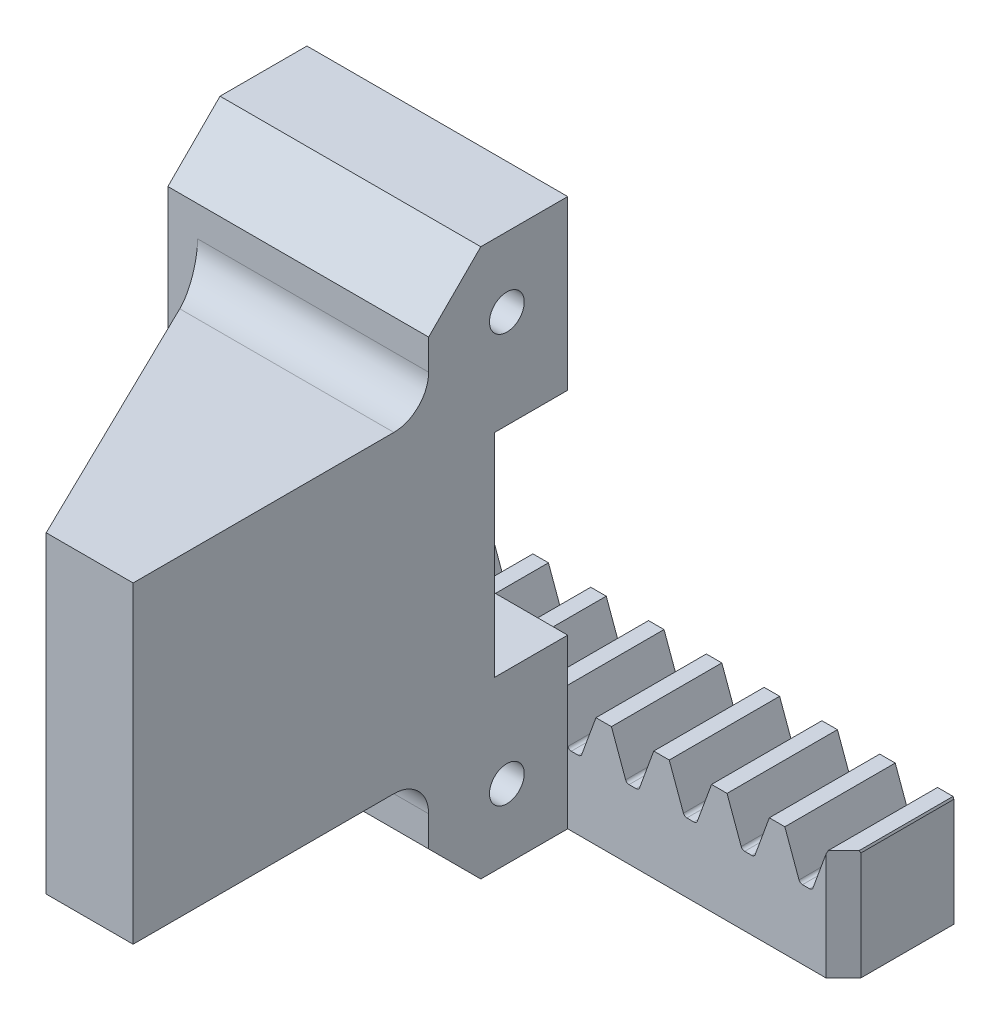
from build123d import *

# Parameters (mm, degrees)
BOSS_EXTRUDE1_START       = -0.808533663
BOSS_EXTRUDE1_DEPTH       = 0.808533663
BOSS_EXTRUDE1_START_2     = 0.611119732
BOSS_EXTRUDE1_2_OUTLINE_W = 1
BOSS_EXTRUDE1_2_OUTLINE_H = 6.35
BOSS_EXTRUDE1_2_DEPTH     = 15.249880268
BOSS_EXTRUDE1_3_OUTLINE_W = 1
BOSS_EXTRUDE1_3_OUTLINE_H = 3.970866667
BOSS_EXTRUDE1_3_DEPTH     = 0.80872757
BOSS_EXTRUDE1_4_OUTLINE_W = 1
BOSS_EXTRUDE1_4_OUTLINE_H = 2.379133333
BOSS_EXTRUDE1_4_DEPTH     = 0.204646605
BOSS_EXTRUDE1_START_3     = 2.175
BOSS_EXTRUDE1_5_DEPTH     = 6
BOSS_EXTRUDE1_START_4     = 12.448968436
BOSS_EXTRUDE1_6_OUTLINE_W = 5
BOSS_EXTRUDE1_6_OUTLINE_H = 8.175
BOSS_EXTRUDE1_6_DEPTH     = 1.551031564
BOSS_EXTRUDE2_START       = 5.35
BOSS_EXTRUDE2_DEPTH       = 5.35
CUT_EXTRUDE1_DEPTH        = 6.35
BOSS_EXTRUDE3_DEPTH       = 14.191466337
BOSS_EXTRUDE4_REACH       = 36.333
CUT_EXTRUDE2_DEPTH        = 6.35
CUT_EXTRUDE3_DEPTH        = 6.35
CUT_EXTRUDE4_DEPTH        = 6.35
CUT_EXTRUDE5_DEPTH        = 6.35
CUT_EXTRUDE6_DEPTH        = 6.35
CUT_EXTRUDE7_DEPTH        = 41.809385627
CUT_EXTRUDE8_DEPTH        = 41.809385627
CUT_EXTRUDE9_DEPTH        = 41.809385627
SKETCH15_W                = 4.2
SKETCH15_H                = 12.2
CUT_EXTRUDE10_DEPTH       = 43.984969129
F_3_CLEARANCE_HOLE1_D     = 2
F_3_CLEARANCE_HOLE1_DEPTH = 30.861103078


with BuildPart() as part:
    # Boss-Extrude1: read off the stored shape, not the designer's step
    # Boss-Extrude1 outline → Boss-Extrude1 (new body)
    with BuildSketch(Plane(origin=(-0.4305, 0, 0), x_dir=(0, 0, -1), z_dir=(1, 0, 0)).offset(BOSS_EXTRUDE1_START)):
        Polygon((-11.175, -0.175), (-8.175, -3.175), (-2.175, -3.175), (-2.175, 28.325), (-8.175, 28.325), (-11.175, 25.325), align=None)
    extrude(amount=BOSS_EXTRUDE1_DEPTH)



with BuildPart() as body_2:
    # Boss-Extrude1 2 outline → Boss-Extrude1 2 (new body)
    with BuildSketch(Plane(origin=(-0.4305, 0, 0), x_dir=(0, 0, -1), z_dir=(1, 0, 0)).offset(BOSS_EXTRUDE1_START_2)):
        with Locations((-2.675, 0)):
            Rectangle(BOSS_EXTRUDE1_2_OUTLINE_W, BOSS_EXTRUDE1_2_OUTLINE_H)
    extrude(amount=BOSS_EXTRUDE1_2_DEPTH)


with BuildPart() as part_1:
    add(part.part)

    add(body_2.part)  # Boss-Extrude1 3 merges body 2
    # Boss-Extrude1 3 outline → Boss-Extrude1 3 (add)
    with BuildSketch(Plane(origin=(-0.4305, 0, 0), x_dir=(0, 0, -1), z_dir=(1, 0, 0))):
        with Locations((-2.675, -1.189566667)):
            Rectangle(BOSS_EXTRUDE1_3_OUTLINE_W, BOSS_EXTRUDE1_3_OUTLINE_H)
    extrude(amount=BOSS_EXTRUDE1_3_DEPTH)

    # Boss-Extrude1 4 outline → Boss-Extrude1 4 (add)
    with BuildSketch(Plane(origin=(-0.4305, 0, 0), x_dir=(0, 0, -1), z_dir=(1, 0, 0))):
        with Locations((-2.675, 1.985433334)):
            Rectangle(BOSS_EXTRUDE1_4_OUTLINE_W, BOSS_EXTRUDE1_4_OUTLINE_H)
    extrude(amount=BOSS_EXTRUDE1_4_DEPTH)

    # Boss-Extrude1 5 outline → Boss-Extrude1 5 (cut)
    with BuildSketch(Plane.XY.offset(BOSS_EXTRUDE1_START_3)):
        with BuildLine():
            Line((0.37822757, 0.934233164), (1.1938, 3.175))
            Line((1.1938, 3.175), (0.180619732, 3.175))
            Line((0.180619732, 3.175), (0.180619732, 0.795866667))
            ThreePointArc((0.180619732, 0.795866667), (0.301237045, 0.83389716), (0.37822757, 0.934233164))
        make_face()
        Polygon((15.385266337, 3.175), (15.4305, 3.050721534), (15.4305, 3.175), align=None)
        with BuildLine():
            Line((-0.4305, 0.953572019), (-0.423461232, 0.934233164))
            ThreePointArc((-0.423461232, 0.934233164), (-0.346470708, 0.83389716), (-0.225853395, 0.795866667))
            Line((-0.225853395, 0.795866667), (-0.225853395, 3.175))
            Line((-0.225853395, 3.175), (-0.4305, 3.175))
            Line((-0.4305, 3.175), (-0.4305, 0.953572019))
        make_face()
    extrude(amount=BOSS_EXTRUDE1_5_DEPTH, mode=Mode.SUBTRACT)

    # Boss-Extrude1 6 outline → Boss-Extrude1 6 (cut)
    with BuildSketch(Plane(origin=(0, 0, 0), x_dir=(0.707106781186545, 0, -0.70710678118655), z_dir=(0.70710678118655, 0, 0.707106781186545)).offset(BOSS_EXTRUDE1_START_4)):
        with Locations((8.5, 0.9125)):
            Rectangle(BOSS_EXTRUDE1_6_OUTLINE_W, BOSS_EXTRUDE1_6_OUTLINE_H)
    extrude(amount=BOSS_EXTRUDE1_6_DEPTH, mode=Mode.SUBTRACT)

    # Sketch2 → Boss-Extrude2 (add)
    with BuildSketch(Plane(origin=(0, 0, 2.175), x_dir=(-1, 0, 0), z_dir=(0, 0, -1)).offset(BOSS_EXTRUDE2_START)):
        with BuildLine():
            Line((1.239033663, -3.175), (-15.4305, -3.175))
            Line((-15.4305, -3.175), (-15.4305, 3.050721534))
            Line((-15.4305, 3.050721534), (-15.385266337, 3.175))
            Line((-15.385266337, 3.175), (-1.1938, 3.175))
            Line((-1.1938, 3.175), (-0.37822757, 0.934233164))
            ThreePointArc((-0.37822757, 0.934233164), (-0.301237046, 0.83389716), (-0.180619732, 0.795866667))
            Line((-0.180619732, 0.795866667), (0.225853395, 0.795866667))
            ThreePointArc((0.225853395, 0.795866667), (0.346470708, 0.83389716), (0.423461232, 0.934233164))
            Line((0.423461232, 0.934233164), (0.4305, 0.953572019))
            Line((0.4305, 0.953572019), (0.4305, 28.325))
            Line((0.4305, 28.325), (1.239033663, 28.325))
            Line((1.239033663, 28.325), (1.239033663, -3.175))
        make_face()
    extrude(amount=-BOSS_EXTRUDE2_DEPTH)

    # Sketch3 → Cut-Extrude1 (cut)
    with BuildSketch(Plane(origin=(0, 0, -3.175), x_dir=(-1, 0, 0), z_dir=(0, 0, -1))):
        Polygon((0.4305, 0.953572019), (1.239033663, 3.175), (1.239033663, 28.325), (0.4305, 28.325), align=None)
    extrude(amount=-CUT_EXTRUDE1_DEPTH, mode=Mode.SUBTRACT)

    # Sketch4 → Boss-Extrude3 (add)
    with BuildSketch(Plane.ZY.offset(1.239033663)):
        Polygon((3.175, 3.175), (3.175, 28.325), (8.175, 28.325), (11.175, 25.325), (11.175, -0.175), (8.175, -3.175), (-3.175, -3.175), (-3.175, 3.175), align=None)
    extrude(amount=BOSS_EXTRUDE3_DEPTH)

    # Boss-Extrude4: up to this plane
    boss_extrude4_end = Plane(origin=(-15.488026312, 0, 7.554015165), z_dir=(-0.8987940462991697, 0, 0.438371146789072))
    # Sketch6 → Boss-Extrude4 (add, up to the surface)
    with BuildSketch(Plane(origin=(-0.4305, 0, 0), x_dir=(0, 0, -1), z_dir=(1, 0, 0)), mode=Mode.PRIVATE) as boss_extrude4_sk1:
        with BuildLine():
            Line((-11.175, 1.575), (-11.175, 23.575))
            ThreePointArc((-11.175, 23.575), (-11.760786438, 22.160786438), (-13.175, 21.575))
            Line((-13.175, 21.575), (-28.175, 21.575))
            Line((-28.175, 21.575), (-28.175, 3.575))
            Line((-28.175, 3.575), (-13.175, 3.575))
            ThreePointArc((-13.175, 3.575), (-11.760786438, 2.989213562), (-11.175, 1.575))
        make_face()
    boss_extrude4_tool1 = split(extrude(boss_extrude4_sk1.sketch, amount=-BOSS_EXTRUDE4_REACH, mode=Mode.PRIVATE), bisect_by=boss_extrude4_end, keep=Keep.BOTH, mode=Mode.PRIVATE)
    add(boss_extrude4_tool1.solids().sort_by_distance((-0.4305, 12.575, 19.630069))[0])

    # Sketch7 → Cut-Extrude2 (cut)
    with BuildSketch(Plane(origin=(0, 0, -3.175), x_dir=(-1, 0, 0), z_dir=(0, 0, -1))):
        with BuildLine():
            Line((2.13106, 3.175), (2.94663243, 0.934233164))
            ThreePointArc((2.94663243, 0.934233164), (3.023622954, 0.83389716), (3.144240268, 0.795866667))
            Line((3.144240268, 0.795866667), (3.550713395, 0.795866667))
            ThreePointArc((3.550713395, 0.795866667), (3.671330708, 0.83389716), (3.748321232, 0.934233164))
            Line((3.748321232, 0.934233164), (4.563893663, 3.175))
            Line((4.563893663, 3.175), (2.13106, 3.175))
        make_face()
    extrude(amount=-CUT_EXTRUDE2_DEPTH, mode=Mode.SUBTRACT)

    # Sketch8 → Cut-Extrude3 (cut)
    with BuildSketch(Plane(origin=(0, 0, -3.175), x_dir=(-1, 0, 0), z_dir=(0, 0, -1))):
        with BuildLine():
            Line((5.45592, 3.175), (6.27149243, 0.934233164))
            ThreePointArc((6.27149243, 0.934233164), (6.348482954, 0.83389716), (6.469100268, 0.795866667))
            Line((6.469100268, 0.795866667), (6.875573395, 0.795866667))
            ThreePointArc((6.875573395, 0.795866667), (6.996190708, 0.83389716), (7.073181232, 0.934233164))
            Line((7.073181232, 0.934233164), (7.888753663, 3.175))
            Line((7.888753663, 3.175), (5.45592, 3.175))
        make_face()
    extrude(amount=-CUT_EXTRUDE3_DEPTH, mode=Mode.SUBTRACT)

    # Sketch9 → Cut-Extrude4 (cut)
    with BuildSketch(Plane(origin=(0, 0, -3.175), x_dir=(-1, 0, 0), z_dir=(0, 0, -1))):
        with BuildLine():
            Line((8.78078, 3.175), (9.59635243, 0.934233164))
            ThreePointArc((9.59635243, 0.934233164), (9.673342954, 0.83389716), (9.793960268, 0.795866667))
            Line((9.793960268, 0.795866667), (10.200433395, 0.795866667))
            ThreePointArc((10.200433395, 0.795866667), (10.321050708, 0.83389716), (10.398041232, 0.934233164))
            Line((10.398041232, 0.934233164), (11.213613663, 3.175))
            Line((11.213613663, 3.175), (8.78078, 3.175))
        make_face()
    extrude(amount=-CUT_EXTRUDE4_DEPTH, mode=Mode.SUBTRACT)

    # Sketch10 → Cut-Extrude5 (cut)
    with BuildSketch(Plane(origin=(0, 0, -3.175), x_dir=(-1, 0, 0), z_dir=(0, 0, -1))):
        with BuildLine():
            Line((12.10564, 3.175), (12.92121243, 0.934233164))
            ThreePointArc((12.92121243, 0.934233164), (12.998202954, 0.83389716), (13.118820268, 0.795866667))
            Line((13.118820268, 0.795866667), (13.525293395, 0.795866667))
            ThreePointArc((13.525293395, 0.795866667), (13.645910708, 0.83389716), (13.722901232, 0.934233164))
            Line((13.722901232, 0.934233164), (14.538473663, 3.175))
            Line((14.538473663, 3.175), (12.10564, 3.175))
        make_face()
    extrude(amount=-CUT_EXTRUDE5_DEPTH, mode=Mode.SUBTRACT)

    # Sketch11 → Cut-Extrude6 (cut)
    with BuildSketch(Plane(origin=(0, 0, -3.175), x_dir=(-1, 0, 0), z_dir=(0, 0, -1))):
        with BuildLine():
            Line((-12.060406337, 3.175), (-14.49324, 3.175))
            Line((-14.49324, 3.175), (-13.67766757, 0.934233164))
            ThreePointArc((-13.67766757, 0.934233164), (-13.600677046, 0.83389716), (-13.480059732, 0.795866667))
            Line((-13.480059732, 0.795866667), (-13.073586605, 0.795866667))
            ThreePointArc((-13.073586605, 0.795866667), (-12.952969292, 0.83389716), (-12.875978768, 0.934233164))
            Line((-12.875978768, 0.934233164), (-12.060406337, 3.175))
        make_face()
    extrude(amount=-CUT_EXTRUDE6_DEPTH, mode=Mode.SUBTRACT)

    # Sketch12 → Cut-Extrude7 (cut, through all)
    with BuildSketch(Plane.XY.offset(3.175)):
        with BuildLine():
            Line((2.085826337, 3.175), (2.901398768, 0.934233164))
            ThreePointArc((2.901398768, 0.934233164), (2.978389292, 0.83389716), (3.099006605, 0.795866667))
            Line((3.099006605, 0.795866667), (3.505479732, 0.795866667))
            ThreePointArc((3.505479732, 0.795866667), (3.626097046, 0.83389716), (3.70308757, 0.934233164))
            Line((3.70308757, 0.934233164), (4.51866, 3.175))
            Line((4.51866, 3.175), (2.085826337, 3.175))
        make_face()
    extrude(amount=-CUT_EXTRUDE7_DEPTH, mode=Mode.SUBTRACT)

    # Sketch13 → Cut-Extrude8 (cut, through all)
    with BuildSketch(Plane.XY.offset(3.175)):
        with BuildLine():
            Line((5.410686337, 3.175), (6.226258768, 0.934233164))
            ThreePointArc((6.226258768, 0.934233164), (6.303249292, 0.83389716), (6.423866605, 0.795866667))
            Line((6.423866605, 0.795866667), (6.830339732, 0.795866667))
            ThreePointArc((6.830339732, 0.795866667), (6.950957046, 0.83389716), (7.02794757, 0.934233164))
            Line((7.02794757, 0.934233164), (7.84352, 3.175))
            Line((7.84352, 3.175), (5.410686337, 3.175))
        make_face()
    extrude(amount=-CUT_EXTRUDE8_DEPTH, mode=Mode.SUBTRACT)

    # Sketch14 → Cut-Extrude9 (cut, through all)
    with BuildSketch(Plane.XY.offset(3.175)):
        with BuildLine():
            Line((8.735546337, 3.175), (9.551118768, 0.934233164))
            ThreePointArc((9.551118768, 0.934233164), (9.628109292, 0.83389716), (9.748726605, 0.795866667))
            Line((9.748726605, 0.795866667), (10.155199732, 0.795866667))
            ThreePointArc((10.155199732, 0.795866667), (10.275817046, 0.83389716), (10.35280757, 0.934233164))
            Line((10.35280757, 0.934233164), (11.16838, 3.175))
            Line((11.16838, 3.175), (8.735546337, 3.175))
        make_face()
    extrude(amount=-CUT_EXTRUDE9_DEPTH, mode=Mode.SUBTRACT)

    # Sketch15 → Cut-Extrude10 (cut, through all)
    with BuildSketch(Plane(origin=(-0.4305, 0, 0), x_dir=(0, 0, -1), z_dir=(1, 0, 0))):
        with Locations((-5.275, 12.575)):
            Rectangle(SKETCH15_W, SKETCH15_H)
    extrude(amount=-CUT_EXTRUDE10_DEPTH, mode=Mode.SUBTRACT)

    # #3 Clearance Hole1
    with Locations(Plane.ZY.offset(15.4305)):
        with Locations((6.675, 24.325), (6.675, 0.825)):
            Hole(F_3_CLEARANCE_HOLE1_D / 2, depth=F_3_CLEARANCE_HOLE1_DEPTH)


solid = part_1.part
